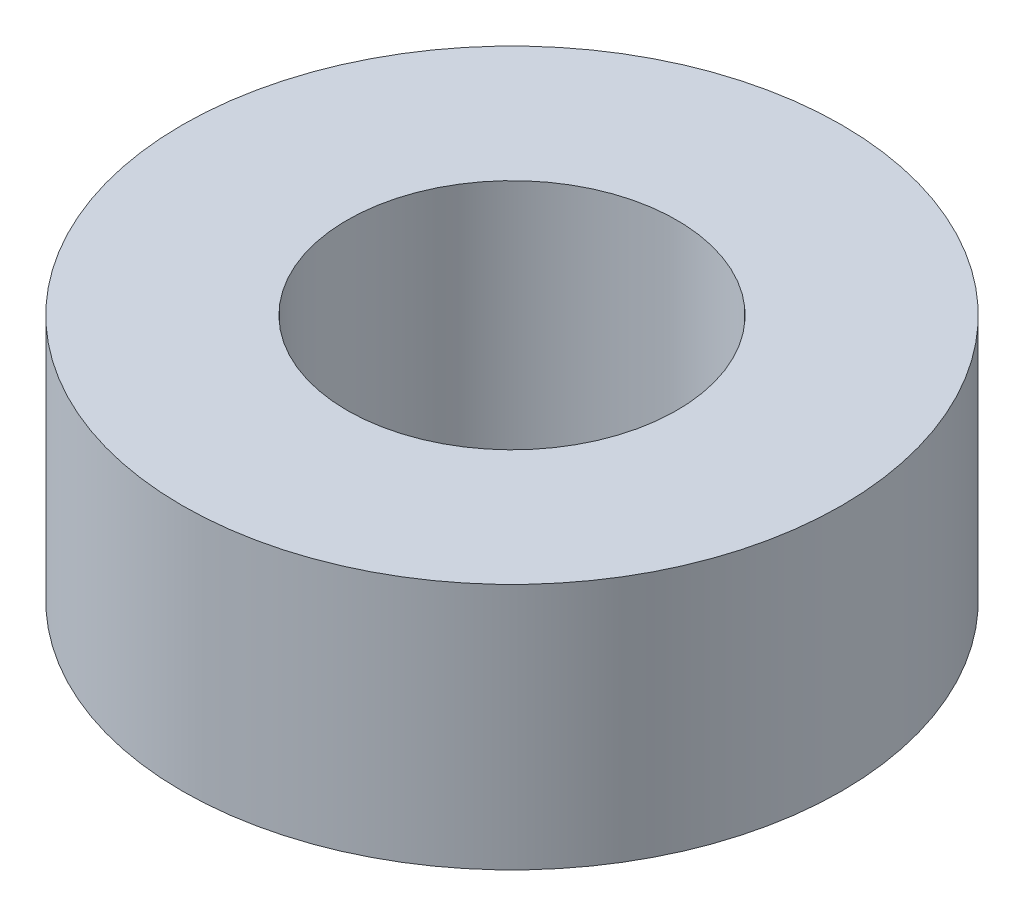
from build123d import *

# Parameters (mm, degrees)
ESQUISSE1_R        = 4
ESQUISSE1_R_2      = 2
BOSS_EXTRU_1_DEPTH = 3


with BuildPart() as part:
    # Esquisse1 → Boss.-Extru.1 (new body)
    with BuildSketch(Plane(origin=(0, 0, 0), x_dir=(1, 0, 0), z_dir=(0, 1, 0))):
        Circle(ESQUISSE1_R)
        Circle(ESQUISSE1_R_2, mode=Mode.SUBTRACT)
    extrude(amount=BOSS_EXTRU_1_DEPTH)


solid = part.part
